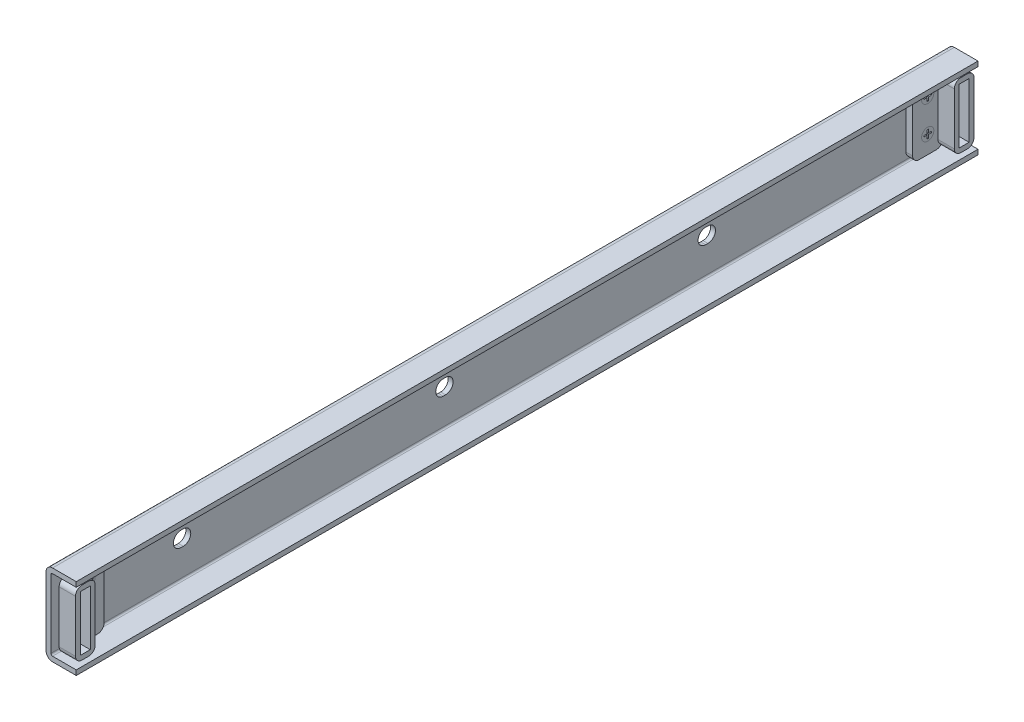
from build123d import *

# Parameters (mm, degrees)
EXTRUDE_THIN1_START  = -137.5
EXTRUDE_THIN1_DEPTH  = 275
BOSS_EXTRUDE1_DEPTH  = 2
SKETCH3_R            = 1.86
BOSS_EXTRUDE2_DEPTH  = 0.001
CUT_EXTRUDE1_DEPTH   = 0.45
CUT_EXTRUDE1_DRAFT   = -5
MIRROR1_COPY_1_DEPTH = 0.45
MIRROR1_COPY_1_DRAFT = -5
SKETCH7_W            = 3
SKETCH7_H            = 16.84
BOSS_EXTRUDE3_DEPTH  = 5
CUT_EXTRUDE2_DEPTH   = 139.273672114
LPATTERN1_COUNT      = 3
LPATTERN1_PITCH      = 80


# Read off the part's stored shape, not the designer's step: Extrude-Thin1
with BuildPart() as part:
    # Extrude-Thin1 outline → Extrude-Thin1 (new body)
    with BuildSketch(Plane.XY.offset(EXTRUDE_THIN1_START)):
        with BuildLine():
            Line((2, -12.4), (9.22, -12.4))
            Line((9.22, -12.4), (9.22, -10.9))
            Line((9.22, -10.9), (2, -10.9))
            ThreePointArc((2, -10.9), (1.646446609, -10.753553391), (1.5, -10.4))
            Line((1.5, -10.4), (1.5, 10.4))
            ThreePointArc((1.5, 10.4), (1.646446609, 10.753553391), (2, 10.9))
            Line((2, 10.9), (9.22, 10.9))
            Line((9.22, 10.9), (9.22, 12.4))
            Line((9.22, 12.4), (2, 12.4))
            ThreePointArc((2, 12.4), (0.585786438, 11.814213562), (0, 10.4))
            Line((0, 10.4), (0, -10.4))
            ThreePointArc((0, -10.4), (0.585786438, -11.814213562), (2, -12.4))
        make_face()
    extrude(amount=EXTRUDE_THIN1_DEPTH)

    # Sketch8 → Cut-Extrude2 (cut, through all)
    with BuildSketch(Plane(origin=(1.5, 0, 0), x_dir=(0, 0, -1), z_dir=(1, 0, 0))):
        with BuildLine():
            Line((-97.85, 2.3), (-97.15, 2.3))
            ThreePointArc((-97.15, 2.3), (-94.85, 0), (-97.15, -2.3))
            Line((-97.15, -2.3), (-97.85, -2.3))
            ThreePointArc((-97.85, -2.3), (-100.15, 0), (-97.85, 2.3))
        make_face()
    cut_extrude2 = extrude(amount=-CUT_EXTRUDE2_DEPTH, mode=Mode.SUBTRACT)

    # LPattern1: Cut-Extrude2 ×3
    with Locations(*[(0, 0, -i * LPATTERN1_PITCH) for i in range(1, LPATTERN1_COUNT)]):
        add(cut_extrude2, mode=Mode.SUBTRACT)


with BuildPart() as body_2:
    # Sketch2 → Boss-Extrude1 (new body)
    with BuildSketch(Plane(origin=(1.5, 0, 0), x_dir=(0, 0, -1), z_dir=(1, 0, 0))):
        with BuildLine():
            Line((125.28, 10.4), (130.5, 10.4))
            ThreePointArc((130.5, 10.4), (131.914213562, 9.814213562), (132.5, 8.4))
            Line((132.5, 8.4), (132.5, -8.4))
            ThreePointArc((132.5, -8.4), (131.914213562, -9.814213562), (130.5, -10.4))
            Line((130.5, -10.4), (125.28, -10.4))
            ThreePointArc((125.28, -10.4), (123.865786438, -9.814213562), (123.28, -8.4))
            Line((123.28, -8.4), (123.28, 8.4))
            ThreePointArc((123.28, 8.4), (123.865786438, 9.814213562), (125.28, 10.4))
        make_face()
    extrude(amount=BOSS_EXTRUDE1_DEPTH)

    # Sketch3 → Boss-Extrude2 (add)
    with BuildSketch(Plane(origin=(3.5, 0, 0), x_dir=(0, 0, -1), z_dir=(1, 0, 0))):
        with Locations((127.89, 4.96)):
            Circle(SKETCH3_R)
    boss_extrude2 = extrude(amount=BOSS_EXTRUDE2_DEPTH)


with BuildPart() as cut_extrude1_tool:
    # Sketch5 → Cut-Extrude1 (with draft: the straight prism first)
    with BuildSketch(Plane(origin=(3.501, 0, 0), x_dir=(0, 0, -1), z_dir=(1, 0, 0))):
        Polygon((127.704, 4.774), (127.704, 3.751), (128.076, 3.751), (128.076, 4.774), (129.099, 4.774), (129.099, 5.146), (128.076, 5.146), (128.076, 6.169), (127.704, 6.169), (127.704, 5.146), (126.681, 5.146), (126.681, 4.774), align=None)
    extrude(amount=-CUT_EXTRUDE1_DEPTH)
    # Cut-Extrude1: the draft: its side faces are tilted about the plane it starts from
    cut_extrude1_sides = [cut_extrude1_tool.faces().sort_by_distance(p)[0] for p in [
        (3.276, 4.2625, -127.704),
        (3.276, 3.751, -127.89),
        (3.276, 4.2625, -128.076),
        (3.276, 4.774, -128.5875),
        (3.276, 4.96, -129.099),
        (3.276, 5.146, -128.5875),
        (3.276, 5.6575, -128.076),
        (3.276, 6.169, -127.89),
        (3.276, 5.6575, -127.704),
        (3.276, 5.146, -127.1925),
        (3.276, 4.96, -126.681),
        (3.276, 4.774, -127.1925),
    ]]
    draft(cut_extrude1_sides, Plane(origin=(3.501, 0, 0), x_dir=(0, 0, -1), z_dir=(1, 0, 0)), CUT_EXTRUDE1_DRAFT)


with BuildPart() as body_2_1:
    add(body_2.part)

    # Cut-Extrude1: cut by cut_extrude1_tool
    add(cut_extrude1_tool.part, mode=Mode.SUBTRACT)

    # Mirror1: Boss-Extrude2 across plane
    add(boss_extrude2.mirror(Plane.ZX))


with BuildPart() as mirror1_copy_1_tool:
    # Mirror1 copy 1 sketch → Mirror1 copy 1 (with draft: the straight prism first)
    with BuildSketch(Plane(origin=(3.501, 0, 0), x_dir=(0, 0, -1), z_dir=(1, 0, 0))):
        Polygon((127.704, -4.774), (127.704, -3.751), (128.076, -3.751), (128.076, -4.774), (129.099, -4.774), (129.099, -5.146), (128.076, -5.146), (128.076, -6.169), (127.704, -6.169), (127.704, -5.146), (126.681, -5.146), (126.681, -4.774), align=None)
    extrude(amount=-MIRROR1_COPY_1_DEPTH)
    # Mirror1 copy 1: the draft: its side faces are tilted about the plane it starts from
    mirror1_copy_1_sides = [mirror1_copy_1_tool.faces().sort_by_distance(p)[0] for p in [
        (3.276, -4.2625, -127.704),
        (3.276, -3.751, -127.89),
        (3.276, -4.2625, -128.076),
        (3.276, -4.774, -128.5875),
        (3.276, -4.96, -129.099),
        (3.276, -5.146, -128.5875),
        (3.276, -5.6575, -128.076),
        (3.276, -6.169, -127.89),
        (3.276, -5.6575, -127.704),
        (3.276, -5.146, -127.1925),
        (3.276, -4.96, -126.681),
        (3.276, -4.774, -127.1925),
    ]]
    draft(mirror1_copy_1_sides, Plane(origin=(3.501, 0, 0), x_dir=(0, 0, -1), z_dir=(1, 0, 0)), MIRROR1_COPY_1_DRAFT)


with BuildPart() as body_2_2:
    add(body_2_1.part)

    # Mirror1 copy 1: cut by mirror1_copy_1_tool
    add(mirror1_copy_1_tool.part, mode=Mode.SUBTRACT)

    # Sketch7 → Boss-Extrude3 (add)
    with BuildSketch(Plane(origin=(3.5, 0, 0), x_dir=(0, 0, -1), z_dir=(1, 0, 0))):
        with BuildLine():
            Line((133, 9.92), (135, 9.92))
            ThreePointArc((135, 9.92), (136.414213562, 9.334213562), (137, 7.92))
            Line((137, 7.92), (137, -7.92))
            ThreePointArc((137, -7.92), (136.414213562, -9.334213562), (135, -9.92))
            Line((135, -9.92), (133, -9.92))
            ThreePointArc((133, -9.92), (131.585786438, -9.334213562), (131, -7.92))
            Line((131, -7.92), (131, 7.92))
            ThreePointArc((131, 7.92), (131.585786438, 9.334213562), (133, 9.92))
        make_face()
        with Locations((134, 0)):
            Rectangle(SKETCH7_W, SKETCH7_H, mode=Mode.SUBTRACT)
    extrude(amount=BOSS_EXTRUDE3_DEPTH)


with BuildPart() as body_3:
    # Mirror2: mirrored copy
    add(body_2_2.part.mirror(Plane.XY))


solid = Compound([part.part, body_2_2.part, body_3.part])
